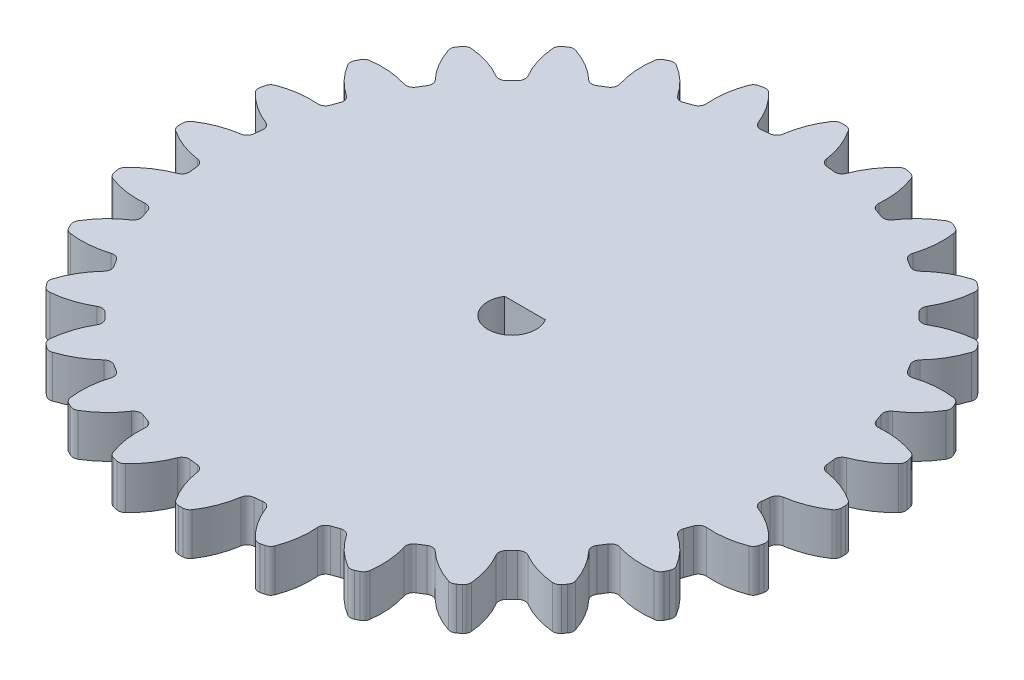
from build123d import *

# Parameters (mm, degrees)
SKETCH1_R                = 19.375
BASE_FLANGE2_DEPTH       = 2.85
TAB1_START               = -2.85
TAB1_DEPTH               = 2.85
FILLET1_R                = 0.5
CIRPATTERN1_COUNT        = 28
FILLET1_OF_CIRPATTERN1_R = 0.5
CUT_EXTRUDE1_DEPTH       = 32.665478198


# Read off the part's stored shape, not the designer's step: Tab1
# Sheet-metal steps are written as plain solids
with BuildPart() as part:
    # Sketch1 → Base-Flange2 (new body)
    with BuildSketch(Plane(origin=(0, 0, 0), x_dir=(1, 0, 0), z_dir=(0, 1, 0))):
        with Locations(Location((0, 0, 0), (0, 0, 270))):
            Circle(SKETCH1_R)
    extrude(amount=-BASE_FLANGE2_DEPTH)

    # Tab1 outline → Tab1 (add)
    with BuildSketch(Plane(origin=(0, 0, 0), x_dir=(1, 0, 0), z_dir=(0, 1, 0)).offset(TAB1_START)):
        with BuildLine():
            ThreePointArc((0.4, 22.296412267), (0, 22.3), (-0.4, 22.296412267))
            ThreePointArc((-0.4, 22.296412267), (-1.157728924, 20.883319923), (-1.5, 19.316848216))
            ThreePointArc((-1.5, 19.316848216), (0, 19.375), (1.5, 19.316848216))
            ThreePointArc((1.5, 19.316848216), (1.157728924, 20.883319923), (0.4, 22.296412267))
        make_face()
    tab1 = extrude(amount=TAB1_DEPTH)

    # Fillet1
    fillet1_edges = [part.edges().sort_by_distance(p)[0] for p in [
        (-1.5, -1.425, -19.316848216),
        (-0.4, -1.425, -22.296412267),
        (0.4, -1.425, -22.296412267),
        (1.5, -1.425, -19.316848216),
    ]]
    fillet(fillet1_edges, radius=FILLET1_R)

    # CirPattern1: Tab1 ×28 about axis
    cirpattern1_axis = Axis((0, 0, 0), (0, 1, 0))
    for i in range(1, CIRPATTERN1_COUNT):
        add(tab1.rotate(cirpattern1_axis, i * 360 / CIRPATTERN1_COUNT))

    # Fillet1 of CirPattern1
    fillet1_of_cirpattern1_edges = [part.edges().sort_by_distance(p)[0] for p in [
        (-5.760794974, -1.425, -18.4987531),
        (-5.351389646, -1.425, -21.648386287),
        (-4.571447317, -1.425, -21.826403034),
        (-2.836011238, -1.425, -19.166315902),
        (-9.732719634, -1.425, -16.75305326),
        (-10.03443827, -1.425, -19.914819823),
        (-9.313663176, -1.425, -20.261926814),
        (-7.02981303, -1.425, -18.054704477),
        (-13.21660509, -1.425, -14.167285375),
        (-14.214318259, -1.425, -17.182641136),
        (-13.588853074, -1.425, -17.681432977),
        (-10.871110643, -1.425, -16.03775478),
        (-16.03775478, -1.425, -10.871110643),
        (-17.681432977, -1.425, -13.588853074),
        (-17.182641136, -1.425, -14.214318259),
        (-14.167285375, -1.425, -13.21660509),
        (-18.054704477, -1.425, -7.02981303),
        (-20.261926814, -1.425, -9.313663176),
        (-19.914819823, -1.425, -10.03443827),
        (-16.75305326, -1.425, -9.732719634),
        (-19.166315902, -1.425, -2.836011238),
        (-21.826403034, -1.425, -4.571447317),
        (-21.648386287, -1.425, -5.351389646),
        (-18.4987531, -1.425, -5.760794974),
        (-19.316848216, -1.425, 1.5),
        (-22.296412267, -1.425, 0.4),
        (-22.296412267, -1.425, -0.4),
        (-19.316848216, -1.425, -1.5),
        (-18.4987531, -1.425, 5.760794974),
        (-21.648386287, -1.425, 5.351389646),
        (-21.826403034, -1.425, 4.571447317),
        (-19.166315902, -1.425, 2.836011238),
        (-16.75305326, -1.425, 9.732719634),
        (-19.914819823, -1.425, 10.03443827),
        (-20.261926814, -1.425, 9.313663176),
        (-18.054704477, -1.425, 7.02981303),
        (-14.167285375, -1.425, 13.21660509),
        (-17.182641136, -1.425, 14.214318259),
        (-17.681432977, -1.425, 13.588853074),
        (-16.03775478, -1.425, 10.871110643),
        (-10.871110643, -1.425, 16.03775478),
        (-13.588853074, -1.425, 17.681432977),
        (-14.214318259, -1.425, 17.182641136),
        (-13.21660509, -1.425, 14.167285375),
        (-7.02981303, -1.425, 18.054704477),
        (-9.313663176, -1.425, 20.261926814),
        (-10.03443827, -1.425, 19.914819823),
        (-9.732719634, -1.425, 16.75305326),
        (-2.836011238, -1.425, 19.166315902),
        (-4.571447317, -1.425, 21.826403034),
        (-5.351389646, -1.425, 21.648386287),
        (-5.760794974, -1.425, 18.4987531),
        (1.5, -1.425, 19.316848216),
        (0.4, -1.425, 22.296412267),
        (-0.4, -1.425, 22.296412267),
        (-1.5, -1.425, 19.316848216),
        (5.760794974, -1.425, 18.4987531),
        (5.351389646, -1.425, 21.648386287),
        (4.571447317, -1.425, 21.826403034),
        (2.836011238, -1.425, 19.166315902),
        (9.732719634, -1.425, 16.75305326),
        (10.03443827, -1.425, 19.914819823),
        (9.313663176, -1.425, 20.261926814),
        (7.02981303, -1.425, 18.054704477),
        (13.21660509, -1.425, 14.167285375),
        (14.214318259, -1.425, 17.182641136),
        (13.588853074, -1.425, 17.681432977),
        (10.871110643, -1.425, 16.03775478),
        (16.03775478, -1.425, 10.871110643),
        (17.681432977, -1.425, 13.588853074),
        (17.182641136, -1.425, 14.214318259),
        (14.167285375, -1.425, 13.21660509),
        (18.054704477, -1.425, 7.02981303),
        (20.261926814, -1.425, 9.313663176),
        (19.914819823, -1.425, 10.03443827),
        (16.75305326, -1.425, 9.732719634),
        (19.166315902, -1.425, 2.836011238),
        (21.826403034, -1.425, 4.571447317),
        (21.648386287, -1.425, 5.351389646),
        (18.4987531, -1.425, 5.760794974),
        (19.316848216, -1.425, -1.5),
        (22.296412267, -1.425, -0.4),
        (22.296412267, -1.425, 0.4),
        (19.316848216, -1.425, 1.5),
        (18.4987531, -1.425, -5.760794974),
        (21.648386287, -1.425, -5.351389646),
        (21.826403034, -1.425, -4.571447317),
        (19.166315902, -1.425, -2.836011238),
        (16.75305326, -1.425, -9.732719634),
        (19.914819823, -1.425, -10.03443827),
        (20.261926814, -1.425, -9.313663176),
        (18.054704477, -1.425, -7.02981303),
        (14.167285375, -1.425, -13.21660509),
        (17.182641136, -1.425, -14.214318259),
        (17.681432977, -1.425, -13.588853074),
        (16.03775478, -1.425, -10.871110643),
        (10.871110643, -1.425, -16.03775478),
        (13.588853074, -1.425, -17.681432977),
        (14.214318259, -1.425, -17.182641136),
        (13.21660509, -1.425, -14.167285375),
        (7.02981303, -1.425, -18.054704477),
        (9.313663176, -1.425, -20.261926814),
        (10.03443827, -1.425, -19.914819823),
        (9.732719634, -1.425, -16.75305326),
        (2.836011238, -1.425, -19.166315902),
        (4.571447317, -1.425, -21.826403034),
        (5.351389646, -1.425, -21.648386287),
        (5.760794974, -1.425, -18.4987531),
    ]]
    fillet(fillet1_of_cirpattern1_edges, radius=FILLET1_OF_CIRPATTERN1_R)

    # Sketch11 → Cut-Extrude1 (cut, through all)
    with BuildSketch(Plane(origin=(0, 0, 0), x_dir=(1, 0, 0), z_dir=(0, 1, 0))):
        with BuildLine():
            Line((-1.369306394, 0.875), (1.369306394, 0.875))
            ThreePointArc((1.369306394, 0.875), (0, -1.625), (-1.369306394, 0.875))
        make_face()
    extrude(amount=-CUT_EXTRUDE1_DEPTH, mode=Mode.SUBTRACT)


solid = part.part
